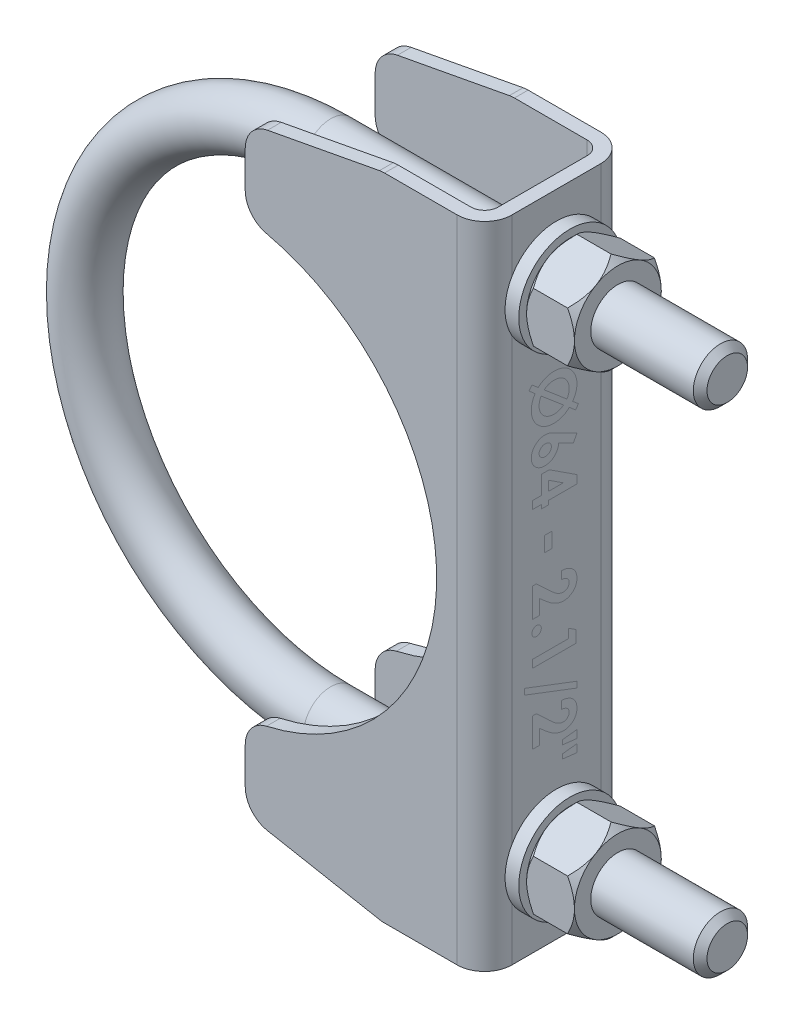
from build123d import *

# Parameters (mm, degrees)
ESBO_O2_R                = 3.96875
CHANFRO1_SIZE            = 1
ESBO_O3_W                = 21
ESBO_O3_H                = 95
RESSALTO_EXTRUS_O1_DEPTH = 2
RESSALTO_EXTRUS_O2_DEPTH = 2
FILETE1_R                = 2
FILETE2_R                = 4
ESBO_O5_R                = 7.5
ESBO_O5_R_2              = 5
RESSALTO_EXTRUS_O3_DEPTH = 2
RESSALTO_EXTRUS_O4_DEPTH = 7


with BuildPart() as part:
    # Varredura1: sweep along a path in Esboço1
    with BuildLine(Plane.XY) as varredura1_path:
        Line((0, 0), (-58, 0))
        ThreePointArc((-58, 0), (-93.96875, 35.96875), (-58, 71.9375))
        Line((-58, 71.9375), (0, 71.9375))
    # Esboço2 → Varredura1 (sweep)
    with BuildSketch(Plane(origin=(0, 0, 0), x_dir=(0, 0, -1), z_dir=(1, 0, 0))):
        Circle(ESBO_O2_R)
    sweep(path=varredura1_path.line)

    # Chanfro1
    chanfro1_edges = [part.edges().sort_by_distance(p)[0] for p in [
        (0, 0, 3.96875),
        (0, 71.9375, 3.96875),
    ]]
    chamfer(chanfro1_edges, length=CHANFRO1_SIZE)



with BuildPart() as body_2:
    # Esboço3 → Ressalto-extrusão1 (new body)
    with BuildSketch(Plane(origin=(-25, 0, 0), x_dir=(0, 0, -1), z_dir=(1, 0, 0))):
        with Locations((0, 35.96875)):
            Rectangle(ESBO_O3_W, ESBO_O3_H)
        with BuildLine():
            Line((4.25, 73.6875), (4.25, 70.1875))
            ThreePointArc((4.25, 70.1875), (0, 65.9375), (-4.25, 70.1875))
            Line((-4.25, 70.1875), (-4.25, 73.6875))
            ThreePointArc((-4.25, 73.6875), (0, 77.9375), (4.25, 73.6875))
        make_face(mode=Mode.SUBTRACT)
        with BuildLine():
            Line((-4.25, -1.75), (-4.25, 1.75))
            ThreePointArc((-4.25, 1.75), (0, 6), (4.25, 1.75))
            Line((4.25, 1.75), (4.25, -1.75))
            ThreePointArc((4.25, -1.75), (0, -6), (-4.25, -1.75))
        make_face(mode=Mode.SUBTRACT)
    extrude(amount=-RESSALTO_EXTRUS_O1_DEPTH)

    # Esboço4 → Ressalto-extrusão2 (add)
    with BuildSketch(Plane.XY.offset(10.5)):
        with BuildLine():
            Line((-27, 83.46875), (-27, -11.53125))
            Line((-27, -11.53125), (-40, -11.53125))
            Line((-40, -11.53125), (-60, -7.780265733))
            Line((-60, -7.780265733), (-60, 4.219734267))
            ThreePointArc((-60, 4.219734267), (-32, 35.96875), (-60, 67.717765733))
            Line((-60, 67.717765733), (-60, 79.717765733))
            Line((-60, 79.717765733), (-40, 83.46875))
            Line((-40, 83.46875), (-27, 83.46875))
        make_face()
    ressalto_extrus_o2 = extrude(amount=-RESSALTO_EXTRUS_O2_DEPTH)

    # Espelhar1: Ressalto-extrusão2 across plane
    add(ressalto_extrus_o2.mirror(Plane.XY))

    # Filete1
    filete1_edges = [body_2.edges().sort_by_distance(p)[0] for p in [
        (-27, 35.96875, 8.5),
        (-27, 35.96875, -8.5),
    ]]
    fillet(filete1_edges, radius=FILETE1_R)

    # Filete2
    filete2_edges = [body_2.edges().sort_by_distance(p)[0] for p in [
        (-60, 67.717765733, -9.5),
        (-60, 79.717765733, -9.5),
        (-60, 4.219734267, -9.5),
        (-60, -7.780265733, -9.5),
        (-60, -7.780265733, 9.5),
        (-60, 4.219734267, 9.5),
        (-60, 67.717765733, 9.5),
        (-60, 79.717765733, 9.5),
        (-40, 83.46875, 9.5),
        (-40, 83.46875, -9.5),
        (-25, 35.96875, -10.5),
        (-25, 35.96875, 10.5),
    ]]
    fillet(filete2_edges, radius=FILETE2_R)

    # Esboço5 → Ressalto-extrusão3 (add)
    # profile 1 of 2: a face of its own
    with BuildSketch(Plane(origin=(-25, 0, 0), x_dir=(0, 0, -1), z_dir=(1, 0, 0))):
        with Locations((0, 71.9375)):
            Circle(ESBO_O5_R)
        with Locations((0, 71.9375)):
            Circle(ESBO_O5_R_2, mode=Mode.SUBTRACT)
    # profile 2 of 2: a face of its own
    with BuildSketch(Plane(origin=(-25, 0, 0), x_dir=(0, 0, -1), z_dir=(1, 0, 0))):
        Circle(ESBO_O5_R)
        Circle(ESBO_O5_R_2, mode=Mode.SUBTRACT)
    extrude(amount=RESSALTO_EXTRUS_O3_DEPTH)


with BuildPart() as part_1:
    add(part.part)

    add(body_2.part)  # Ressalto-extrusão4 merges body 2
    # Esboço6 → Ressalto-extrusão4 (add)
    with BuildSketch(Plane(origin=(-23, 0, 0), x_dir=(0, 0, -1), z_dir=(1, 0, 0))):
        Polygon((-6.35, 75.603674209), (-6.35, 68.271325791), (0, 64.605151581), (6.35, 68.271325791), (6.35, 75.603674209), (0, 79.269848419), align=None)
        Polygon((6.35, 3.666174209), (0, 7.332348419), (-6.35, 3.666174209), (-6.35, -3.666174209), (0, -7.332348419), (6.35, -3.666174209), align=None)
    extrude(amount=RESSALTO_EXTRUS_O4_DEPTH)

    # Esboço7 → Corte-Revolução1 (revolve, cut)
    with BuildSketch(Plane.XY):
        Polygon((-16, 78.2875), (-16, 79.269848419), (-17, 79.269848419), align=None)
        Polygon((-23, 78.2875), (-23, 79.269848419), (-22, 79.269848419), align=None)
    revolve(axis=Axis((0, 71.9375, 0), (-1, 0, 0)), mode=Mode.SUBTRACT)

    # Esboço8 → Corte-Revolução2 (revolve, cut)
    with BuildSketch(Plane.XY):
        Polygon((-16, 7.332348419), (-17, 7.332348419), (-16, 6.35), align=None)
        Polygon((-23, 6.35), (-23, 7.332348419), (-22, 7.332348419), align=None)
    revolve(axis=Axis((0, 0, 0), (-1, 0, 0)), mode=Mode.SUBTRACT)


solid = part_1.part
